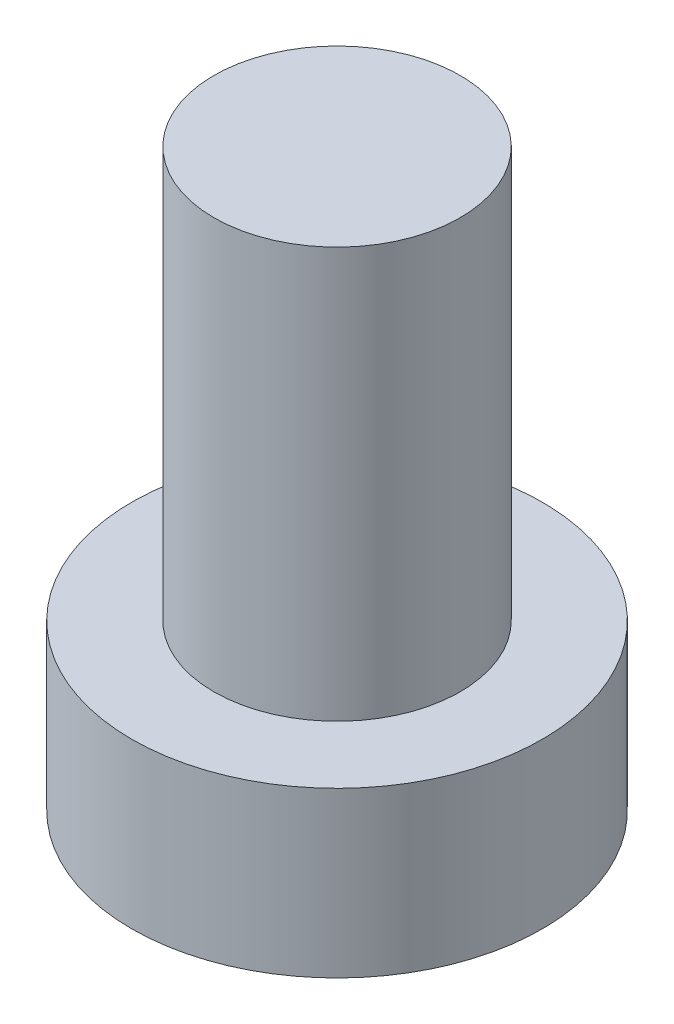
from build123d import *

# Parameters (mm, degrees)
SKETCH1_R           = 5
BOSS_EXTRUDE1_DEPTH = 14
CUT_EXTRUDE1_START  = -10
SKETCH2_R           = 5
SKETCH2_R_2         = 3
CUT_EXTRUDE1_DEPTH  = 10


with BuildPart() as part:
    # Sketch1 → Boss-Extrude1 (new body)
    with BuildSketch(Plane(origin=(0, 0, 0), x_dir=(-1, 0, 0), z_dir=(0, 1, 0))):
        Circle(SKETCH1_R)
    extrude(amount=BOSS_EXTRUDE1_DEPTH)

    # Sketch2 → Cut-Extrude1 (cut)
    with BuildSketch(Plane(origin=(0, 14, 0), x_dir=(-1, 0, 0), z_dir=(0, 1, 0)).offset(CUT_EXTRUDE1_START)):
        Circle(SKETCH2_R)
        Circle(SKETCH2_R_2, mode=Mode.SUBTRACT)
    extrude(amount=CUT_EXTRUDE1_DEPTH, mode=Mode.SUBTRACT)


solid = part.part
